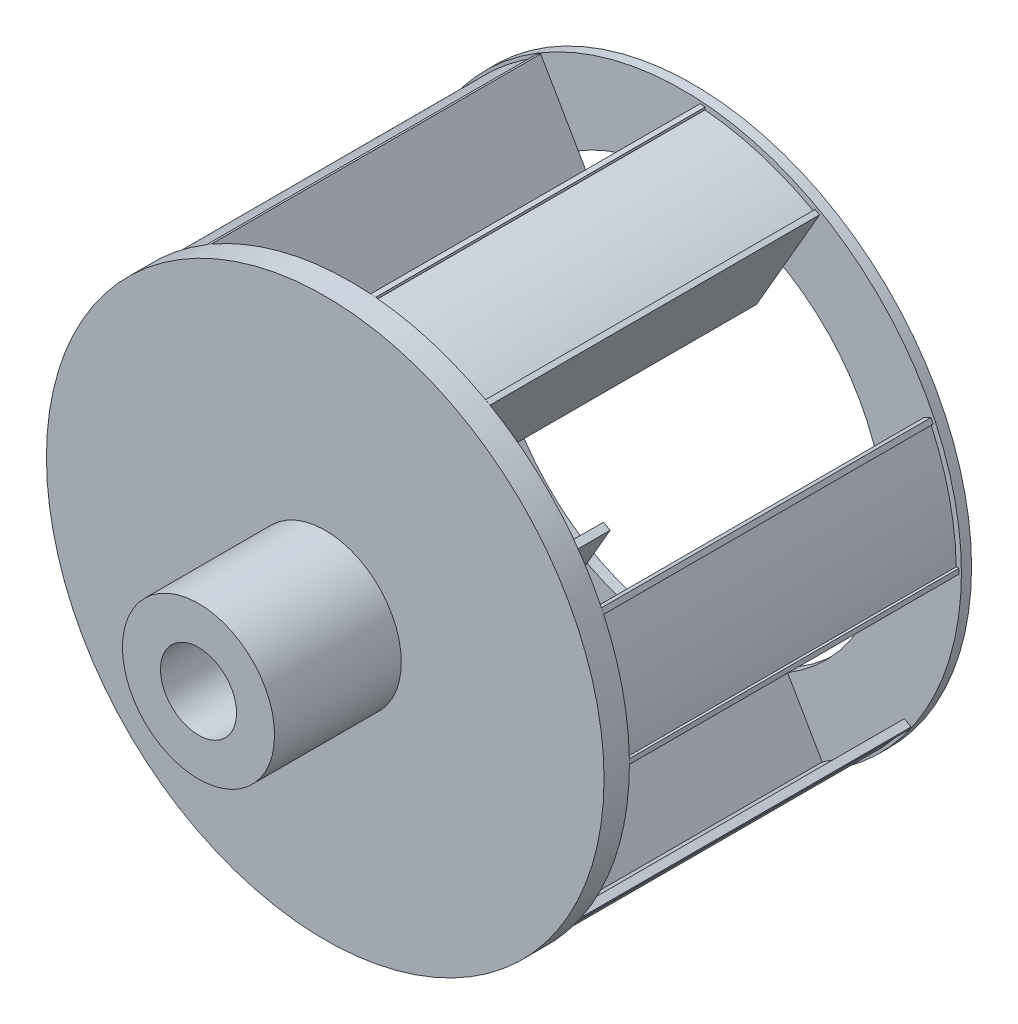
from build123d import *

# Parameters (mm, degrees)
SKETCH1_R           = 139.7
BOSS_EXTRUDE1_DEPTH = 6.35
SKETCH2_R           = 38.1
BOSS_EXTRUDE2_DEPTH = 63.5
SKETCH3_R           = 19.05
CUT_EXTRUDE1_DEPTH  = 212.751316407
EXTRUDE_THIN1_DEPTH = 165.1
CIRPATTERN1_COUNT   = 6
SKETCH6_R           = 139.7
SKETCH6_R_2         = 101.6
BOSS_EXTRUDE3_DEPTH = 5.08


# Read off the part's stored shape, not the designer's step: Extrude-Thin1
with BuildPart() as part:
    # Sketch1 → Boss-Extrude1 (new, symmetric)
    with BuildSketch(Plane.XY):
        Circle(SKETCH1_R)
    extrude(amount=BOSS_EXTRUDE1_DEPTH, both=True)

    # Sketch2 → Boss-Extrude2 (add)
    with BuildSketch(Plane.XY.offset(6.35)):
        Circle(SKETCH2_R)
    extrude(amount=BOSS_EXTRUDE2_DEPTH)

    # Sketch3 → Cut-Extrude1 (cut, through all)
    with BuildSketch(Plane.XY.offset(69.85)):
        Circle(SKETCH3_R)
    extrude(amount=-CUT_EXTRUDE1_DEPTH, mode=Mode.SUBTRACT)

    # Extrude-Thin1 outline → Extrude-Thin1 (add)
    with BuildSketch(Plane(origin=(0, 0, -6.35), x_dir=(-1, 0, 0), z_dir=(0, 0, -1))):
        with BuildLine():
            Line((-138.406695286, 2.54), (-139.7, 2.54))
            Line((-139.7, 2.54), (-139.7, 0))
            Line((-139.7, 0), (-76.708, 0))
            Line((-76.708, 0), (-76.708, 3.81))
            Line((-76.708, 3.81), (-135.836578284, 3.81))
            ThreePointArc((-135.836578284, 3.81), (-132.001666757, 32.274635137), (-122.269799969, 59.297454545))
            Line((-122.269799969, 59.297454545), (-125.697925202, 60.96))
            Line((-125.697925202, 60.96), (-126.806288838, 58.674583178))
            Line((-126.806288838, 58.674583178), (-125.642611535, 58.11023203))
            ThreePointArc((-125.642611535, 58.11023203), (-134.916721648, 30.989403347), (-138.406695286, 2.54))
        make_face()
    extrude_thin1 = extrude(amount=EXTRUDE_THIN1_DEPTH)

    # CirPattern1: Extrude-Thin1 ×6 about axis
    cirpattern1_axis = Axis((0, 0, 0), (0, 0, 1))
    for i in range(1, CIRPATTERN1_COUNT):
        add(extrude_thin1.rotate(cirpattern1_axis, i * 360 / CIRPATTERN1_COUNT))


with BuildPart() as body_2:
    # Sketch6 → Boss-Extrude3 (new body)
    with BuildSketch(Plane.XY.offset(-177.8)):
        Circle(SKETCH6_R)
        Circle(SKETCH6_R_2, mode=Mode.SUBTRACT)
    extrude(amount=BOSS_EXTRUDE3_DEPTH)


solid = Compound([part.part, body_2.part])
